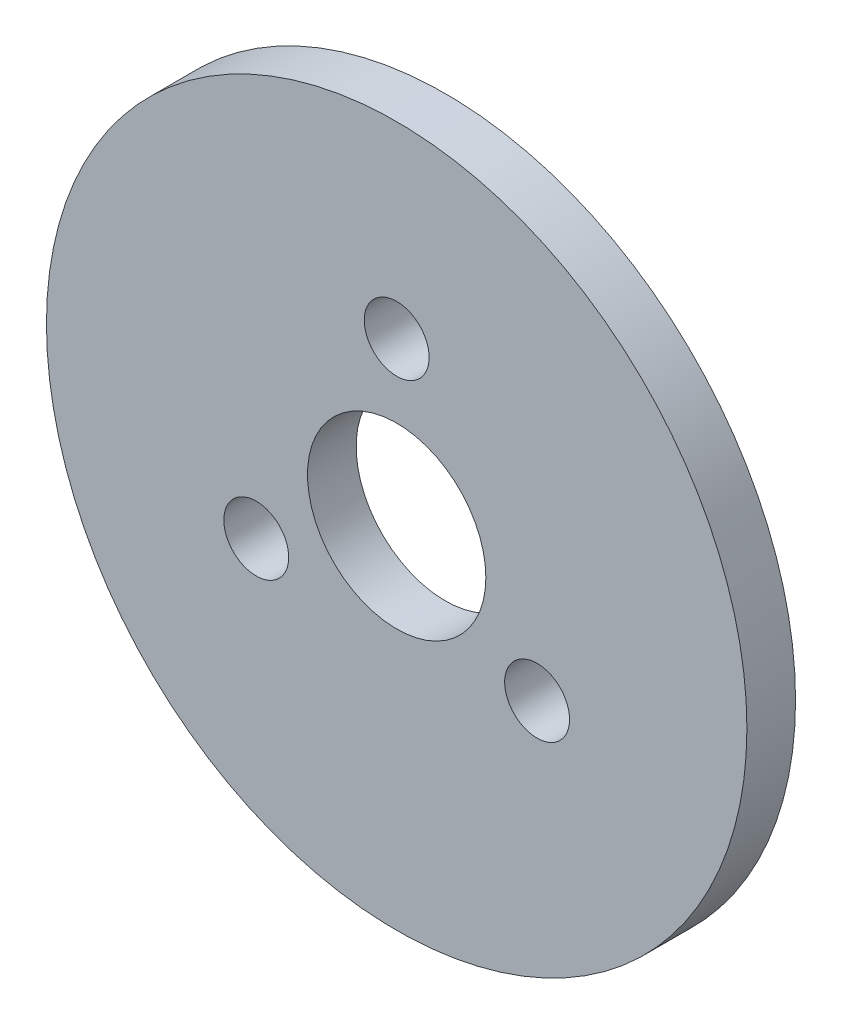
from build123d import *

# Parameters (mm, degrees)
SKETCH1_R           = 21.6
SKETCH1_R_2         = 5.5
BOSS_EXTRUDE1_DEPTH = 3
SKETCH2_R           = 2
CUT_EXTRUDE1_DEPTH  = 3


with BuildPart() as part:
    # Sketch1 → Boss-Extrude1 (new body)
    with BuildSketch(Plane.XY):
        Circle(SKETCH1_R)
        Circle(SKETCH1_R_2, mode=Mode.SUBTRACT)
    extrude(amount=BOSS_EXTRUDE1_DEPTH)

    # Sketch2 → Cut-Extrude1 (cut)
    with BuildSketch(Plane.XY.offset(3)):
        with Locations((0, 10)):
            Circle(SKETCH2_R)
        with Locations((8.660254038, -5)):
            Circle(SKETCH2_R)
        with Locations((-8.660254038, -5)):
            Circle(SKETCH2_R)
    extrude(amount=-CUT_EXTRUDE1_DEPTH, mode=Mode.SUBTRACT)


solid = part.part
